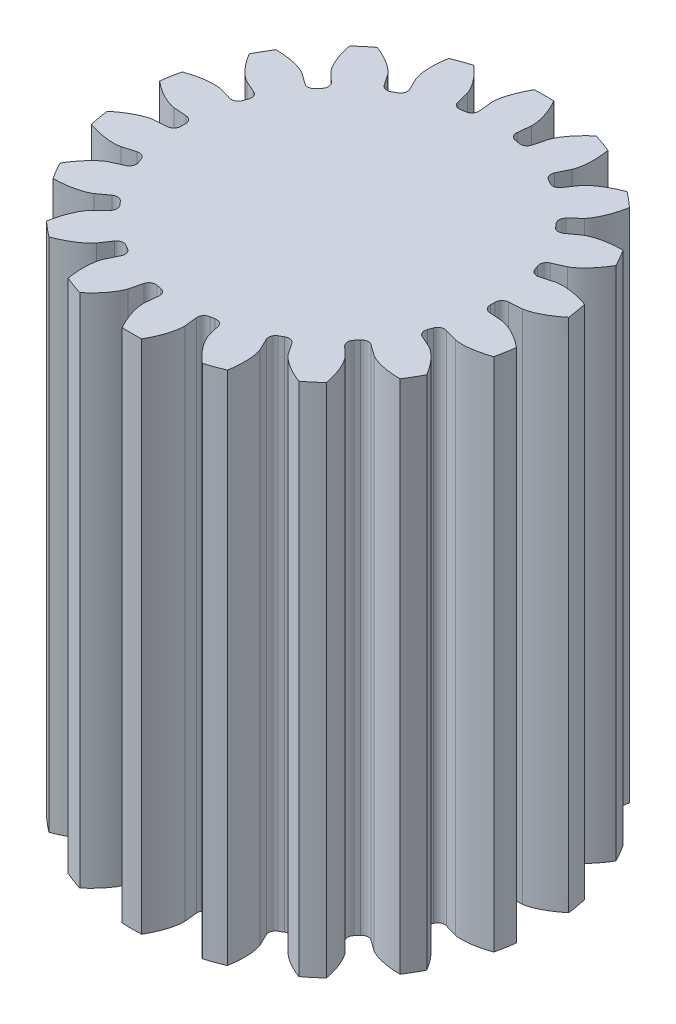
from build123d import *

# Parameters (mm, degrees)
SKETCH1_R           = 10
GEAR_BOSS_DEPTH     = 12.5
TOOTH_CUT_DEPTH     = 19.874586088
TOOTH_PATTERN_COUNT = 18


with BuildPart() as part:
    # Sketch1 → Gear Boss (new, symmetric)
    with BuildSketch(Plane(origin=(0, 0, 0), x_dir=(1, 0, 0), z_dir=(0, 1, 0))):
        Circle(SKETCH1_R)
    extrude(amount=GEAR_BOSS_DEPTH, both=True)

    # Sketch2 → Tooth Cut (cut, symmetric)
    with BuildSketch(Plane(origin=(0, 0, 0), x_dir=(1, 0, 0), z_dir=(0, 1, 0))):
        with BuildLine():
            add(Edge.make_bspline(
                [(8.442511153, 0.498803946), (8.444994068, 0.498983929), (8.451950645, 0.49959139), (8.473384983, 0.502129527), (8.515487329, 0.508996783), (8.567152568, 0.520139093), (8.626198074, 0.535486938), (8.682846856, 0.552288753), (8.731058065, 0.567884468), (8.778928048, 0.584583352), (8.826402956, 0.602245293), (8.883644446, 0.624848924), (8.951902378, 0.653631437), (9.031088825, 0.689705916), (9.120161446, 0.73348028), (9.210095577, 0.781130506), (9.297876331, 0.830507153), (9.385689922, 0.883233113), (9.470028813, 0.936257591), (9.556666512, 0.994209208), (9.636151351, 1.049166844), (9.724074184, 1.113889671), (9.794704088, 1.167044432), (9.86668282, 1.224557653), (9.901568569, 1.252932848), (9.919334765, 1.267595289)],
                knots=[0, 0, 0, 0, 0, 0.005376749, 0.015083688, 0.04661014, 0.092110526, 0.119476176, 0.146842496, 0.174208854, 0.201574956, 0.228941013, 0.256307345, 0.307035032, 0.361767352, 0.416499661, 0.471231937, 0.525964282, 0.580696616, 0.635428982, 0.690161387, 0.744893688, 0.799626082, 0.854358407, 0.909090915, 0.909090915, 0.909090915, 0.909090915, 0.909090915], degree=4))
            Line((8.442511153, 0.498803946), (7.810354485, 0.452979765))
            ThreePointArc((7.810354485, 0.452979765), (7.587228123, 0.344991816), (7.499144384, 0.113285049))
            ThreePointArc((7.499144384, 0.113285049), (7.5, 0), (7.499144384, -0.113285049))
            ThreePointArc((7.499144384, -0.113285049), (7.587228123, -0.344991816), (7.810354485, -0.452979765))
            Line((7.810354485, -0.452979765), (8.442511153, -0.498803946))
            add(Edge.make_bspline(
                [(8.442511153, -0.498803946), (8.444994068, -0.498983929), (8.451950645, -0.49959139), (8.473384983, -0.502129527), (8.515487329, -0.508996783), (8.567152568, -0.520139093), (8.626198074, -0.535486938), (8.682846856, -0.552288753), (8.731058065, -0.567884468), (8.778928048, -0.584583352), (8.826402956, -0.602245293), (8.883644446, -0.624848924), (8.951902378, -0.653631437), (9.031088825, -0.689705916), (9.120161446, -0.73348028), (9.210095577, -0.781130506), (9.297876331, -0.830507153), (9.385689922, -0.883233113), (9.470028813, -0.936257591), (9.556666512, -0.994209208), (9.636151351, -1.049166844), (9.724074184, -1.113889671), (9.794704088, -1.167044432), (9.86668282, -1.224557653), (9.901568569, -1.252932848), (9.919334765, -1.267595289)],
                knots=[0, 0, 0, 0, 0, 0.005376749, 0.015083688, 0.04661014, 0.092110526, 0.119476176, 0.146842496, 0.174208854, 0.201574956, 0.228941013, 0.256307345, 0.307035032, 0.361767352, 0.416499661, 0.471231937, 0.525964282, 0.580696616, 0.635428982, 0.690161387, 0.744893688, 0.799626082, 0.854358407, 0.909090915, 0.909090915, 0.909090915, 0.909090915, 0.909090915], degree=4))
            ThreePointArc((9.919334765, -1.267595289), (9.979813316, -0.63507966), (10, 0))
            ThreePointArc((10, 0), (9.979813316, 0.63507966), (9.919334765, 1.267595289))
        make_face()
    tooth_cut = extrude(amount=TOOTH_CUT_DEPTH, both=True, mode=Mode.SUBTRACT)

    # Tooth Pattern: Tooth Cut ×18 about axis
    tooth_pattern_axis = Axis((0, -13.75, 0), (0, 1, 0))
    for i in range(1, TOOTH_PATTERN_COUNT):
        add(tooth_cut.rotate(tooth_pattern_axis, i * 360 / TOOTH_PATTERN_COUNT), mode=Mode.SUBTRACT)


solid = part.part
